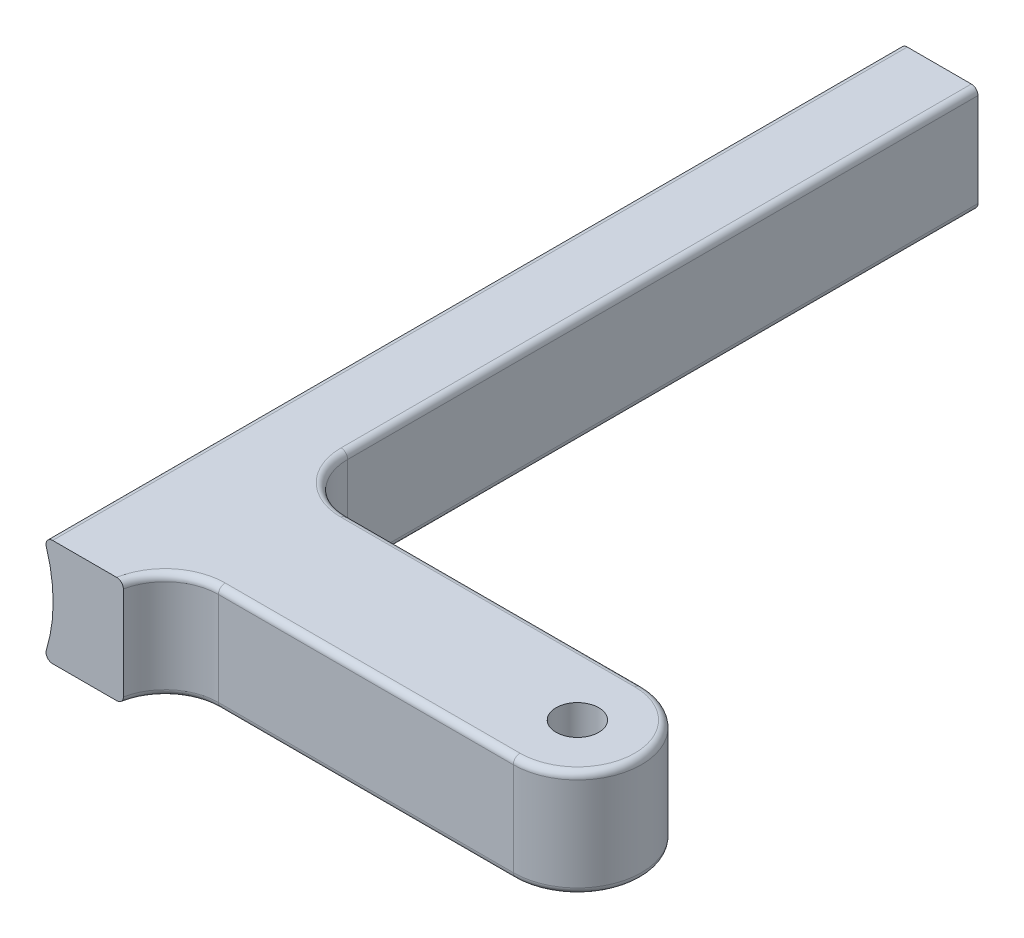
from build123d import *

# Parameters (mm, degrees)
SKETCH1_R               = 1.27
BOSS_EXTRUDE1_DEPTH     = 3.175
FILLET1_R               = 3.175
CUT_EXTRUDE1_DEPTH      = 57.884801353
CUT_EXTRUDE1_DEPTH_BACK = 57.884801353
SKETCH3_R               = 8.89
FILLET2_R               = 0.396875


with BuildPart() as part:
    # Sketch1 → Boss-Extrude1 (new, symmetric)
    with BuildSketch(Plane(origin=(0, 0, 0), x_dir=(1, 0, 0), z_dir=(0, 1, 0))):
        with BuildLine():
            Line((-20.6375, -3.81), (-20.6375, -6.35))
            Line((-20.6375, -6.35), (-25.4, -6.35))
            Line((-25.4, -6.35), (-25.4, 44.45))
            Line((-25.4, 44.45), (-20.6375, 44.45))
            Line((-20.6375, 44.45), (-20.6375, 3.81))
            Line((-20.6375, 3.81), (0, 3.81))
            ThreePointArc((0, 3.81), (3.81, 0), (0, -3.81))
            Line((0, -3.81), (-20.6375, -3.81))
        make_face()
        with Locations(Location((0, 0, 0), (0, 0, 270))):
            Circle(SKETCH1_R, mode=Mode.SUBTRACT)
    extrude(amount=BOSS_EXTRUDE1_DEPTH, both=True)

    # Fillet1
    # the kernel refuses this fillet: 3.175 mm, written as the material it adds along each edge
    with BuildSketch(Plane(origin=(-20.6375, 3.175, 3.81), x_dir=(1, 0, 0), z_dir=(0, -1, 0))) as fillet1_piece_1:
        with BuildLine():
            CenterArc((3.110851973, 3.175), FILLET1_R, 191.536959033, 78.463040967)
            Line((0, 2.54), (-0.062217039, 2.5273))
            ThreePointArc((-0.062217039, 2.5273), (-0.0635, 1.27), (-0.0635, 0))
            Line((-0.0635, 0), (0, -0.0635))
            Line((0, -0.0635), (3.110851973, -0.0635))
            Line((3.110851973, -0.0635), (3.110851973, 0))
        make_face()
    extrude(amount=6.35)
    with BuildSketch(Plane(origin=(-20.6375, -3.175, -3.81), x_dir=(1, 0, 0), z_dir=(0, 1, 0))) as fillet1_piece_2:
        with BuildLine():
            CenterArc((FILLET1_R, FILLET1_R), FILLET1_R, 180, 90)
            Line((0, FILLET1_R), (-FILLET1_R * 0.02, FILLET1_R))
            Line((-FILLET1_R * 0.02, FILLET1_R), (-FILLET1_R * 0.02, -FILLET1_R * 0.02))
            Line((-FILLET1_R * 0.02, -FILLET1_R * 0.02), (FILLET1_R, -FILLET1_R * 0.02))
            Line((FILLET1_R, -FILLET1_R * 0.02), (FILLET1_R, 0))
        make_face()
    extrude(amount=6.35)

    # Sketch3 → Cut-Extrude1 (cut, two sides: drawn at the far end of the back side and taken through both)
    with BuildSketch(Plane.XY.offset(6.35).offset(-CUT_EXTRUDE1_DEPTH_BACK)):
        with Locations((-33.703702487, 0)):
            Circle(SKETCH3_R)
    extrude(amount=CUT_EXTRUDE1_DEPTH + CUT_EXTRUDE1_DEPTH_BACK, mode=Mode.SUBTRACT)

    # Fillet2
    fillet2_edges = [part.edges().sort_by_distance(p)[0] for p in [
        (-8.73125, -3.175, -3.81),
        (3.81, -3.175, 0),
        (-25.4, 3.175, -19.05),
        (-8.763324013, -3.175, 3.81),
        (-8.763324013, 3.175, 3.81),
        (-20.6375, -3.175, -25.7175),
        (-20.6375, 3.175, -25.7175),
        (-19.534694341, -3.175, 4.525655575),
        (-19.534694341, 3.175, 4.525655575),
        (-19.70756403, -3.175, -4.73993597),
        (-19.70756403, 3.175, -4.73993597),
        (3.81, 3.175, 0),
        (-8.73125, 3.175, -3.81),
        (-25.4, -3.175, -19.05),
    ]]
    fillet(fillet2_edges, radius=FILLET2_R)


solid = part.part
